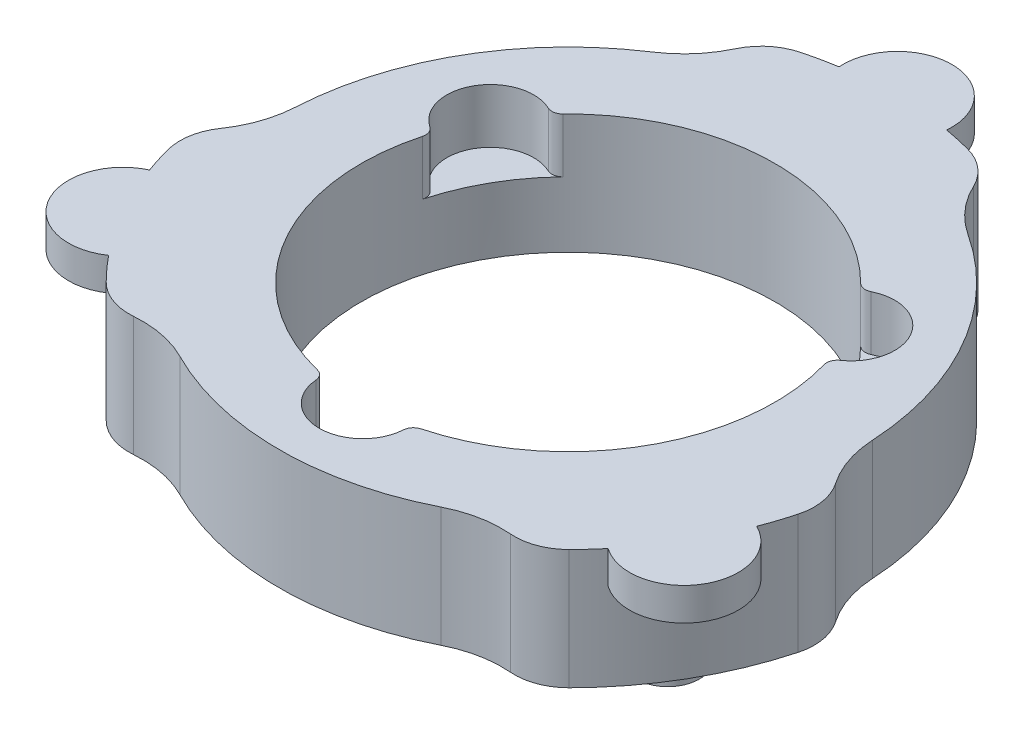
from build123d import *

# Parameters (mm, degrees)
SKETCH1_R                = 19
BOSS_EXTRUDE1_DEPTH      = 3.5
SKETCH2_R                = 30
SKETCH2_R_2              = 19
SKETCH2_R_3              = 2.8
BOSS_EXTRUDE2_DEPTH      = 11
BOSS_EXTRUDE3_DEPTH      = 2
BOSS_EXTRUDE3_DEPTH_BACK = 11
SKETCH4_R                = 2.9
SKETCH5_R                = 5
BOSS_EXTRUDE4_DEPTH      = 3
CUT_EXTRUDE1_START       = -10
SKETCH3_R                = 19
CUT_EXTRUDE1_DEPTH       = 10
CUT_EXTRUDE3_START       = -13
CUT_EXTRUDE3_DEPTH       = 13
FILLET1_R                = 10
FILLET2_R                = 5
CUT_EXTRUDE4_START       = -5
SKETCH8_R                = 4
SKETCH8_R_2              = 19
CUT_EXTRUDE4_DEPTH       = 11
FILLET3_R                = 1


with BuildPart() as part:
    # Sketch1 → Boss-Extrude1 (new body)
    with BuildSketch(Plane(origin=(0, 0, 0), x_dir=(1, 0, 0), z_dir=(0, 1, 0))):
        with Locations(Location((0, 0, 0), (0, 0, 270))):
            Circle(SKETCH1_R)
    extrude(amount=BOSS_EXTRUDE1_DEPTH)

    # Sketch2 → Boss-Extrude2 (add)
    with BuildSketch(Plane(origin=(0, 0, 0), x_dir=(1, 0, 0), z_dir=(0, 1, 0))):
        with Locations(Location((0, 0, 0), (0, 0, 270))):
            Circle(SKETCH2_R)
        with Locations(Location((0, 0, 0), (0, 0, 270))):
            Circle(SKETCH2_R_2, mode=Mode.SUBTRACT)
        with Locations(Location((0, 25, 0), (0, 0, 270))):
            Circle(SKETCH2_R_3, mode=Mode.SUBTRACT)
        with Locations(Location((21.650635095, -12.5, 0), (0, 0, 270))):
            Circle(SKETCH2_R_3, mode=Mode.SUBTRACT)
        with Locations(Location((-21.650635095, -12.5, 0), (0, 0, 270))):
            Circle(SKETCH2_R_3, mode=Mode.SUBTRACT)
    extrude(amount=BOSS_EXTRUDE2_DEPTH)

    # Sketch4 → Boss-Extrude3 (add, two sides: drawn at the far end of the back side and taken through both)
    with BuildSketch(Plane.XZ.offset(-BOSS_EXTRUDE3_DEPTH_BACK)):
        with Locations(Location((-21.650635095, 12.5, 0), (0, 0, 270))):
            Circle(SKETCH4_R)
        with Locations(Location((21.650635095, 12.5, 0), (0, 0, 270))):
            Circle(SKETCH4_R)
        with Locations(Location((0, -25, 0), (0, 0, 270))):
            Circle(SKETCH4_R)
    extrude(amount=BOSS_EXTRUDE3_DEPTH + BOSS_EXTRUDE3_DEPTH_BACK)

    # Sketch5 → Boss-Extrude4 (add)
    with BuildSketch(Plane(origin=(0, 11, 0), x_dir=(1, 0, 0), z_dir=(0, 1, 0))):
        with Locations((-26.103110985, -14.7860609)):
            Circle(SKETCH5_R)
        with Locations((0.246451131, 29.99898768)):
            Circle(SKETCH5_R)
        with Locations((25.856659853, -15.212926781)):
            Circle(SKETCH5_R)
    extrude(amount=-BOSS_EXTRUDE4_DEPTH)

    # Sketch3 → Cut-Extrude1 (cut)
    with BuildSketch(Plane(origin=(0, 3.5, 0), x_dir=(1, 0, 0), z_dir=(0, 1, 0)).offset(CUT_EXTRUDE1_START)):
        with Locations(Location((0, 0, 0), (0, 0, 270))):
            Circle(SKETCH3_R)
    extrude(amount=CUT_EXTRUDE1_DEPTH, mode=Mode.SUBTRACT)

    # Sketch7 → Cut-Extrude3 (cut)
    with BuildSketch(Plane(origin=(0, 11, 0), x_dir=(1, 0, 0), z_dir=(0, 1, 0)).offset(CUT_EXTRUDE3_START)):
        with BuildLine():
            ThreePointArc((-29.54423259, -5.20944533), (-25.980762114, 15), (-10.2606043, 28.190778624))
            Line((-10.2606043, 28.190778624), (-13.773984089, 37.84371026))
            Line((-13.773984089, 37.84371026), (-43.939319858, -7.747687605))
            Line((-43.939319858, -7.747687605), (-29.54423259, -5.20944533))
        make_face()
        with BuildLine():
            ThreePointArc((-26.13264562, -4.6078905), (-22.980662881, 13.267891901), (-9.075772579, 24.935480225))
            Line((-9.075772579, 24.935480225), (-10.2606043, 28.190778624))
            ThreePointArc((-10.2606043, 28.190778624), (-25.980762114, 15), (-29.54423259, -5.20944533))
            Line((-29.54423259, -5.20944533), (-26.13264562, -4.6078905))
        make_face()
        with BuildLine():
            Line((15.259965643, 41.926411025), (10.2606043, 28.190778624))
            ThreePointArc((10.2606043, 28.190778624), (25.980762114, 15), (29.54423259, -5.20944533))
            Line((29.54423259, -5.20944533), (39.660606503, -6.993234998))
            Line((39.660606503, -6.993234998), (15.259965643, 41.926411025))
        make_face()
        with BuildLine():
            Line((10.2606043, 28.190778624), (9.075772579, 24.935480225))
            ThreePointArc((9.075772579, 24.935480225), (21.736841548, 15.220300308), (26.535783801, 0))
            ThreePointArc((26.535783801, 0), (26.434807132, -2.312745947), (26.13264562, -4.6078905))
            Line((26.13264562, -4.6078905), (29.54423259, -5.20944533))
            ThreePointArc((29.54423259, -5.20944533), (25.980762114, 15), (10.2606043, 28.190778624))
        make_face()
        with BuildLine():
            Line((28.679354216, -34.17872342), (19.283628291, -22.981333294))
            ThreePointArc((19.283628291, -22.981333294), (0, -30), (-19.283628291, -22.981333294))
            Line((-19.283628291, -22.981333294), (-25.886622414, -30.850475262))
            Line((-25.886622414, -30.850475262), (28.679354216, -34.17872342))
        make_face()
        with BuildLine():
            Line((19.283628291, -22.981333294), (17.056873041, -20.327589725))
            ThreePointArc((17.056873041, -20.327589725), (0, -26.535783801), (-17.056873041, -20.327589725))
            Line((-17.056873041, -20.327589725), (-19.283628291, -22.981333294))
            ThreePointArc((-19.283628291, -22.981333294), (0, -30), (19.283628291, -22.981333294))
        make_face()
    extrude(amount=CUT_EXTRUDE3_DEPTH, mode=Mode.SUBTRACT)

    # Fillet1
    # the kernel refuses this fillet: 10 mm, written as the material it adds along each edge
    with BuildSketch(Plane(origin=(-26.13264562, 0, 4.6078905), x_dir=(-0.9848077530122318, 0, 0.17364817766679624), z_dir=(0, 1, 0)), Plane(origin=(17.056873041, 0, 20.327589725), x_dir=(0.6427876096865569, 0, 0.7660444431189634), z_dir=(0, 1, 0)), Plane(origin=(9.075772579, 0, -24.935480225), x_dir=(0.34202014332561265, 0, -0.9396926207859289), z_dir=(0, 1, 0))) as fillet1_piece_1:
        with BuildLine():
            CenterArc((9.045274498, -8.297697769), FILLET1_R, 123.92490422, 42.948020906)
            Line((-0.693413056, -6.026582466), (-0.888186807, -5.98116016))
            ThreePointArc((-0.888186807, -5.98116016), (-0.372612378, -3.01031053), (-0.2, 0))
            Line((-0.2, 0), (0, 0.2))
            ThreePointArc((0, 0.2), (1.732108099, 0.2), (3.352595033, 0.165953955))
            Line((3.352595033, 0.165953955), (3.464216199, 0))
        make_face()
    extrude(amount=11)
    with BuildSketch(Plane(origin=(-17.056873041, 0, 20.327589725), x_dir=(0.8344973728156843, 0, 0.551011918894429), z_dir=(0, 1, 0)), Plane(origin=(26.13264562, 0, 4.6078905), x_dir=(0.059941633142754296, 0, -0.99820188369697), z_dir=(0, 1, 0)), Plane(origin=(-9.075772579, 0, -24.935480225), x_dir=(-0.8944390059584274, 0, 0.44718996480254386), z_dir=(0, 1, 0))) as fillet1_piece_2:
        with BuildLine():
            CenterArc((7.20939257, -9.934457095), FILLET1_R, 96.563537437, 42.948020906)
            Line((-0.39597707, -3.441510719), (-0.548084463, -3.311651792))
            ThreePointArc((-0.548084463, -3.311651792), (-0.396677677, -1.697894369), (-0.198689142, 0.022860991))
            Line((-0.198689142, 0.022860991), (0.022860991, 0.198689142))
            ThreePointArc((0.022860991, 0.198689142), (3.03317152, 0.026076764), (6.04348205, 0.198689142))
            Line((6.04348205, 0.198689142), (6.06634304, 0))
        make_face()
    extrude(amount=11)

    # Fillet2
    fillet2_edges = [part.edges().sort_by_distance(p)[0] for p in [
        (-10.2606043, 5.5, -28.190778624),
        (-29.54423259, 5.5, 5.20944533),
        (-19.283628291, 5.5, 22.981333294),
        (19.283628291, 5.5, 22.981333294),
        (29.54423259, 5.5, 5.20944533),
        (10.2606043, 5.5, -28.190778624),
    ]]
    fillet(fillet2_edges, radius=FILLET2_R)

    # Sketch8 → Cut-Extrude4 (cut)
    with BuildSketch(Plane(origin=(0, 11, 0), x_dir=(1, 0, 0), z_dir=(0, 1, 0)).offset(CUT_EXTRUDE4_START)):
        with Locations((-16.524893724, 9.376987118)):
            Circle(SKETCH8_R)
        with Locations(Location((0, 0, 0), (0, 0, 42.512080704))):
            Circle(SKETCH8_R_2)
        with Locations((16.383155917, 9.622484201)):
            Circle(SKETCH8_R)
        with Locations((0.141737807, -18.999471319)):
            Circle(SKETCH8_R)
    extrude(amount=CUT_EXTRUDE4_DEPTH, mode=Mode.SUBTRACT)

    # Fillet3
    fillet3_edges = [part.edges().sort_by_distance(p)[0] for p in [
        (4.116263726, 8.5, 18.548756641),
        (-3.83907012, 8.5, 18.608104165),
        (14.005562597, 8.5, -12.839167276),
        (18.034625983, 8.5, -5.979319831),
        (-18.121826323, 8.5, -5.709589366),
        (-14.195555863, 8.5, -12.628784333),
    ]]
    fillet(fillet3_edges, radius=FILLET3_R)


solid = part.part
